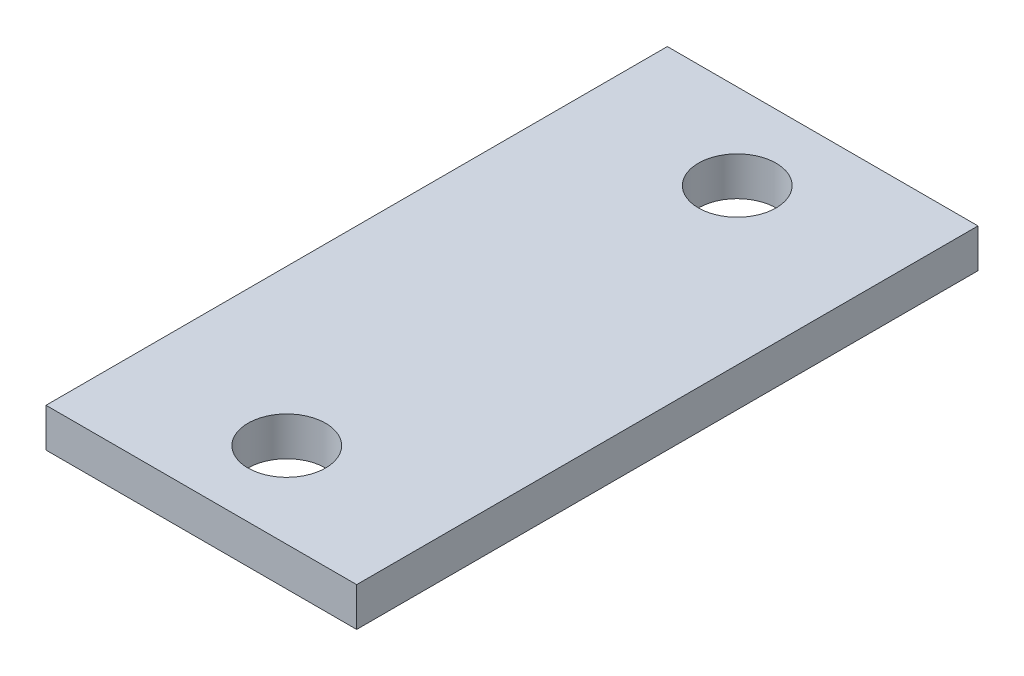
from build123d import *

# Parameters (mm, degrees)
SKETCH1_W    = 50.8
SKETCH1_H    = 101.6
SKETCH1_R    = 6.35
HAMMER_DEPTH = 6.35


with BuildPart() as part:
    # Sketch1 → Hammer (new body)
    with BuildSketch(Plane(origin=(0, 0, 0), x_dir=(1, 0, 0), z_dir=(0, 1, 0))):
        with Locations((25.4, 50.8)):
            Rectangle(SKETCH1_W, SKETCH1_H)
        with Locations((25.4, 13.97)):
            Circle(SKETCH1_R, mode=Mode.SUBTRACT)
        with Locations((25.4, 87.63)):
            Circle(SKETCH1_R, mode=Mode.SUBTRACT)
    extrude(amount=HAMMER_DEPTH)


solid = part.part
